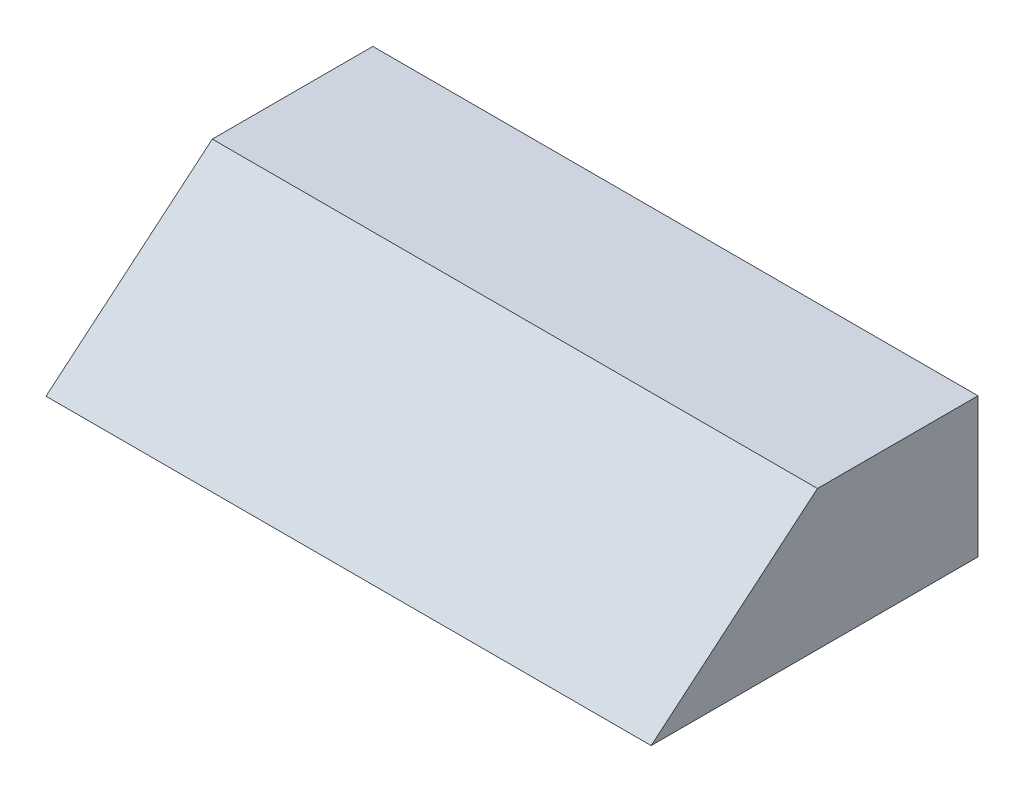
from build123d import *

# Parameters (mm, degrees)
SALIENTE_EXTRUIR1_DEPTH = 196
VACIADO1_T              = -4


with BuildPart() as part:
    # Croquis1 → Saliente-Extruir1 (new body)
    with BuildSketch(Plane(origin=(0, 0, 0), x_dir=(0, 0, -1), z_dir=(1, 0, 0))):
        Polygon((0, 0), (105.85, 0), (105.85, 45.19), (53.855344849, 45.19), align=None)
    extrude(amount=SALIENTE_EXTRUIR1_DEPTH)

    # Vaciado1
    vaciado1_openings = [part.faces().sort_by_distance(p)[0] for p in [
        (98, 0, -52.925),
    ]]
    offset(amount=VACIADO1_T, openings=vaciado1_openings, kind=Kind.INTERSECTION)


solid = part.part
